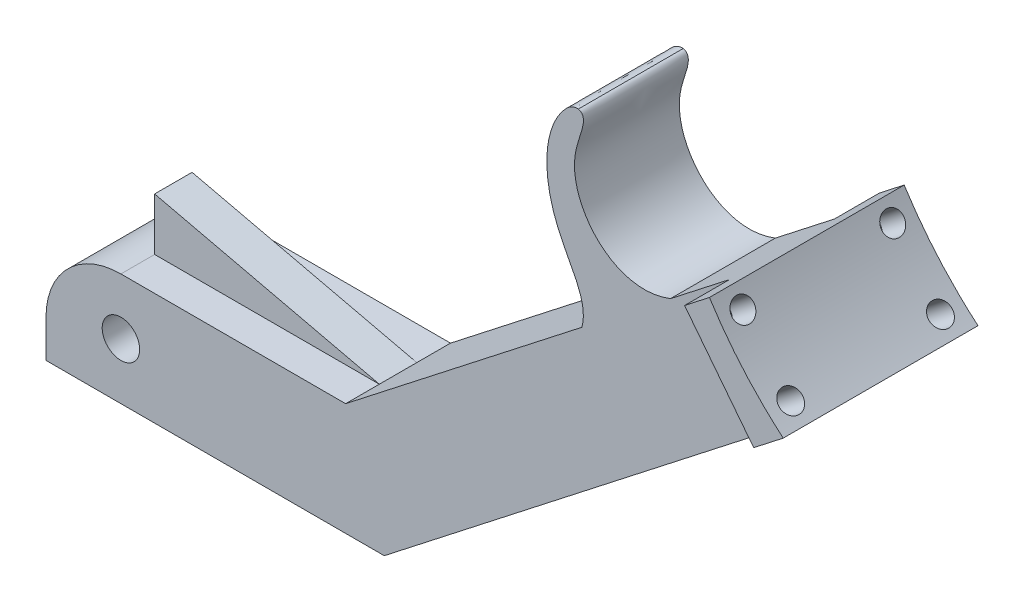
from build123d import *

# Parameters (mm, degrees)
SALIENTE_EXTRUIR1_DEPTH = 7
CROQUIS2_R              = 2.5
CORTAR_EXTRUIR1_DEPTH   = 40
SALIENTE_EXTRUIR2_DEPTH = 6
CORTAR_EXTRUIR2_DEPTH   = 85.364465566
CROQUIS6_R              = 1.5
CORTAR_EXTRUIR3_DEPTH   = 109.399183933
SALIENTE_EXTRUIR3_DEPTH = 2.5
CORTAR_EXTRUIR4_REACH   = 110.399
CROQUIS8_R              = 1.5
CORTAR_EXTRUIR5_REACH   = 84.713
CROQUIS9_R              = 2.5
REDONDEO1_R             = 10


with BuildPart() as part:
    # Croquis1 → Saliente-Extruir1 (new, symmetric)
    with BuildSketch(Plane.XY):
        with BuildLine():
            Line((-73.337453264, -31.996979), (-73.337453264, -16.996979))
            Line((-73.337453264, -16.996979), (-53.337453264, -16.996979))
            Line((-53.337453264, -16.996979), (-33.337453264, -16.996979))
            Line((-33.337453264, -16.996979), (-1.797677202, 7.604698299))
            add(Edge.make_bspline(
                [(-2.271099828, 32.600215317), (-3.120681365, 32.65086638), (-7.140387905, 28.930110418), (-6.851052057, 20.6561771), (-2.970338985, 13.597919356), (-1.149563969, 10.022107474), (-1.797677202, 7.604698299)],
                knots=[0, 0, 0, 0, 0.086865993, 0.573729713, 0.74320117, 1, 1, 1, 1], degree=3))
            add(Edge.make_bspline(
                [(-2.271099828, 32.600215317), (-1.957854214, 32.571324686), (-1.550967765, 32.095962064), (-1.625633045, 30.678221383), (-2.293917384, 28.99060688), (-4.114943029, 21.538574705), (2.702714569, 13.937286445), (10.029738822, 16.830327286)],
                knots=[0, 0, 0, 0, 0.035853338, 0.067043674, 0.168417902, 0.258672943, 1, 1, 1, 1], degree=3))
            Line((10.029738822, 16.830327286), (21.857154848, 26.05595627))
            Line((21.857154848, 26.05595627), (31.082783835, 14.228540246))
            Line((31.082783835, 14.228540246), (-28.179131834, -31.996979))
            Line((-28.179131834, -31.996979), (-73.337453264, -31.996979))
        make_face()
    extrude(amount=SALIENTE_EXTRUIR1_DEPTH, both=True)

    # Croquis2 → Cortar-Extruir1 (cut)
    with BuildSketch(Plane.XY.offset(7)):
        with Locations((-63.337453264, -12.196140351)):
            Circle(CROQUIS2_R)
    extrude(amount=-CORTAR_EXTRUIR1_DEPTH, mode=Mode.SUBTRACT)

    # Croquis4 → Saliente-Extruir2 (add)
    with BuildSketch(Plane.XY.offset(7)):
        Polygon((21.857154848, 26.05595627), (17.914682839, 22.980746608), (27.140311824, 11.153330581), (31.082783835, 14.228540246), align=None)
    saliente_extruir2 = extrude(amount=SALIENTE_EXTRUIR2_DEPTH)

    # Simetría1: Saliente-Extruir2 across plane
    add(saliente_extruir2.mirror(Plane.XY))

    # Croquis5 → Cortar-Extruir2 (cut, through all)
    with BuildSketch(Plane.XY.offset(13)):
        with BuildLine():
            Line((21.227925662, 25.565144498), (21.857154848, 26.05595627))
            Line((21.857154848, 26.05595627), (31.082783835, 14.228540246))
            add(Edge.make_bspline(
                [(31.082783835, 14.228540246), (25.291900343, 19.151696697), (21.227925662, 25.565144498)],
                knots=[0, 0, 0, 1, 1, 1], degree=2))
        make_face()
    extrude(amount=-CORTAR_EXTRUIR2_DEPTH, mode=Mode.SUBTRACT)

    # Croquis6 → Cortar-Extruir3 (cut, through all)
    with BuildSketch(Plane(origin=(22.282654611, 17.3809312, 0), x_dir=(0, 0, 1), z_dir=(-0.7884944017253559, -0.6150419322678522, 0))):
        with Locations((-20.725956244, 4.101908899)):
            Circle(CROQUIS6_R)
        with Locations((-20.725956244, -4.898091102)):
            Circle(CROQUIS6_R)
    cortar_extruir3 = extrude(amount=-CORTAR_EXTRUIR3_DEPTH, mode=Mode.SUBTRACT)

    # Simetría2: Cortar-Extruir3 across plane
    add(cortar_extruir3.mirror(Plane.XY), mode=Mode.SUBTRACT)

    # Croquis7 → Saliente-Extruir3 (add, symmetric)
    with BuildSketch(Plane.XY):
        Polygon((-33.337453264, -16.996979), (-47.567565233, -16.996979), (-63.337565233, -16.996979), (-63.337565233, -9.996979), align=None)
    extrude(amount=SALIENTE_EXTRUIR3_DEPTH, both=True)

    # Croquis8 → Cortar-Extruir4 (cut, up to next)
    with BuildSketch(Plane(origin=(22.282654611, 17.3809312, 0), x_dir=(0, 0, 1), z_dir=(-0.7884944017253558, -0.6150419322678521, 0)), mode=Mode.PRIVATE) as cortar_extruir4_sk1:
        with Locations(Location((-10, 4.479600053, 0), (0, 0, 270))):
            Circle(CROQUIS8_R)
    cortar_extruir4_tool1 = extrude(cortar_extruir4_sk1.sketch, amount=-CORTAR_EXTRUIR4_REACH, mode=Mode.PRIVATE) & part.part
    # Croquis8 → Cortar-Extruir4 (cut, up to next)
    with BuildSketch(Plane(origin=(22.282654611, 17.3809312, 0), x_dir=(0, 0, 1), z_dir=(-0.7884944017253558, -0.6150419322678521, 0)), mode=Mode.PRIVATE) as cortar_extruir4_sk2:
        with Locations(Location((-10, -5.235729918, 0), (0, 0, 270))):
            Circle(CROQUIS8_R)
    cortar_extruir4_tool2 = extrude(cortar_extruir4_sk2.sketch, amount=-CORTAR_EXTRUIR4_REACH, mode=Mode.PRIVATE) & part.part
    cortar_extruir4_1 = cortar_extruir4_tool1.solids().sort_by_distance((19.527513, 20.913071, -10))[0]
    add(cortar_extruir4_1, mode=Mode.SUBTRACT)
    cortar_extruir4_2 = cortar_extruir4_tool2.solids().sort_by_distance((25.502848, 13.252587, -10))[0]
    add(cortar_extruir4_2, mode=Mode.SUBTRACT)
    cortar_extruir4 = cortar_extruir4_1 + cortar_extruir4_2  # Cortar-Extruir4 as one shape, for the pattern or mirror that repeats it

    # Simetría3: Cortar-Extruir4 across plane
    add(cortar_extruir4.mirror(Plane.XY), mode=Mode.SUBTRACT)

    # Croquis9 → Cortar-Extruir5 (cut, up to next)
    with BuildSketch(Plane.XY.offset(7), mode=Mode.PRIVATE) as cortar_extruir5_sk1:
        with Locations((-63.337453264, -24.496979)):
            Circle(CROQUIS9_R)
    cortar_extruir5_tool1 = extrude(cortar_extruir5_sk1.sketch, amount=-CORTAR_EXTRUIR5_REACH, mode=Mode.PRIVATE) & part.part
    add(cortar_extruir5_tool1.solids().sort_by_distance((-63.337453, -24.496979, 7))[0], mode=Mode.SUBTRACT)

    # Redondeo1
    # the kernel refuses this fillet: 10 mm, written as the material it takes off along each edge
    with BuildSketch(Plane(origin=(-73.337453264, -16.996979, 32), x_dir=(0, -1, 0), z_dir=(0, 0, -1))) as redondeo1_piece_1:
        with BuildLine():
            CenterArc((REDONDEO1_R, -REDONDEO1_R), REDONDEO1_R, 90, 90)
            Line((0, -REDONDEO1_R), (0, 0))
            Line((0, 0), (REDONDEO1_R, 0))
        make_face()
    extrude(amount=64, mode=Mode.SUBTRACT)


solid = part.part
